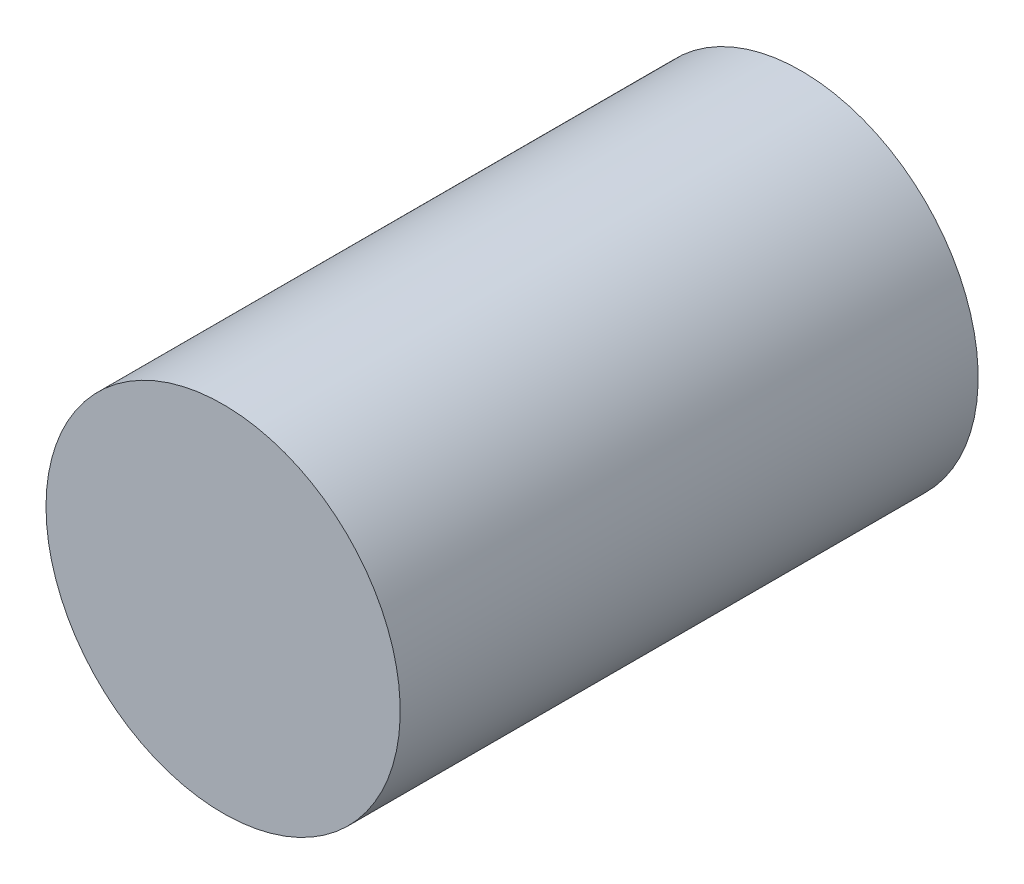
from build123d import *

# Parameters (mm, degrees)
SKETCH1_R           = 57
BOSS_EXTRUDE1_DEPTH = 186
SKETCH2_R           = 31.83061868
CUT_EXTRUDE1_DEPTH  = 10
FILLET1_R           = 10


with BuildPart() as part:
    # Sketch1 → Boss-Extrude1 (new body)
    with BuildSketch(Plane.XY):
        with Locations(Location((0, 0, 0), (0, 0, 180))):
            Circle(SKETCH1_R)
    extrude(amount=BOSS_EXTRUDE1_DEPTH)

    # Sketch2 → Cut-Extrude1 (cut)
    with BuildSketch(Plane(origin=(0, 0, 0), x_dir=(-1, 0, 0), z_dir=(0, 0, -1))):
        Circle(SKETCH2_R)
    extrude(amount=-CUT_EXTRUDE1_DEPTH, mode=Mode.SUBTRACT)

    # Fillet1
    fillet1_edges = [part.edges().sort_by_distance(p)[0] for p in [
        (31.83061868, 0, 10),
    ]]
    fillet(fillet1_edges, radius=FILLET1_R - 0.0001)  # a hair under: the kernel refuses the full size


solid = part.part
